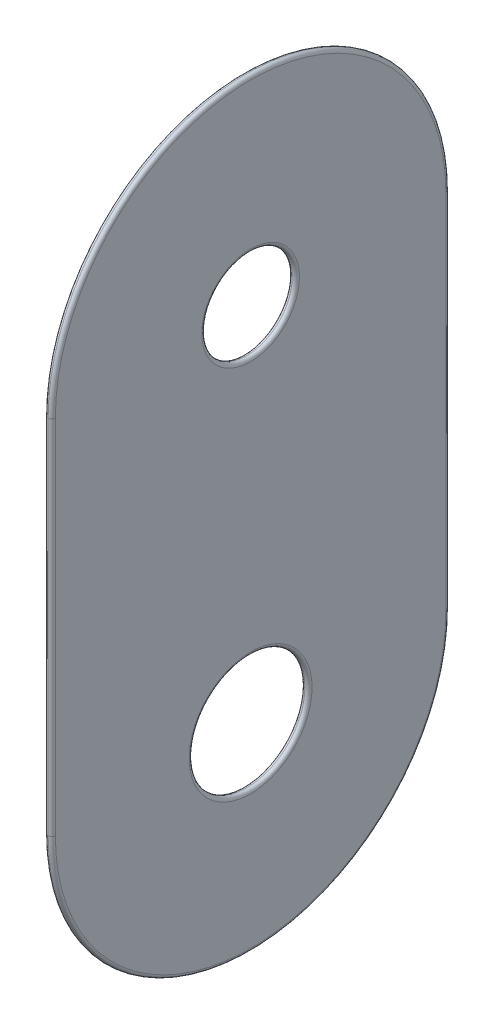
from build123d import *

# Parameters (mm, degrees)
SKETCH2_R           = 3.175
SKETCH2_R_2         = 4.064
BOSS_EXTRUDE1_DEPTH = 0.254
FILLET1_R           = 0.254
FILLET2_R           = 0.254


with BuildPart() as part:
    # Sketch2 → Boss-Extrude1 (new, symmetric)
    with BuildSketch(Plane(origin=(0, 0, 0), x_dir=(0, 0, -1), z_dir=(1, 0, 0))):
        with BuildLine():
            Line((13.97, 12.7), (13.97, -12.7))
            ThreePointArc((13.97, -12.7), (0, -26.67), (-13.97, -12.7))
            Line((-13.97, -12.7), (-13.97, 12.7))
            ThreePointArc((-13.97, 12.7), (0, 26.67), (13.97, 12.7))
        make_face()
        with Locations((0, 12.7)):
            Circle(SKETCH2_R, mode=Mode.SUBTRACT)
        with Locations((0, -12.7)):
            Circle(SKETCH2_R_2, mode=Mode.SUBTRACT)
    extrude(amount=BOSS_EXTRUDE1_DEPTH, both=True)

    # Fillet1
    fillet1_edges = [part.edges().sort_by_distance(p)[0] for p in [
        (0.254, -26.67, 0),
        (0.254, 12.7, 3.175),
        (0.254, 0, -13.97),
        (0.254, -12.7, 4.064),
        (0.254, 26.67, 0),
        (0.254, 0, 13.97),
    ]]
    fillet(fillet1_edges, radius=FILLET1_R)

    # Fillet2
    fillet2_edges = [part.edges().sort_by_distance(p)[0] for p in [
        (-0.254, -12.7, 4.064),
        (-0.254, 12.7, 3.175),
        (-0.254, 0, 13.97),
        (-0.254, -26.67, 0),
        (-0.254, 0, -13.97),
        (-0.254, 26.67, 0),
    ]]
    fillet(fillet2_edges, radius=FILLET2_R - 0.0001)  # a hair under: the kernel refuses the full size


solid = part.part
